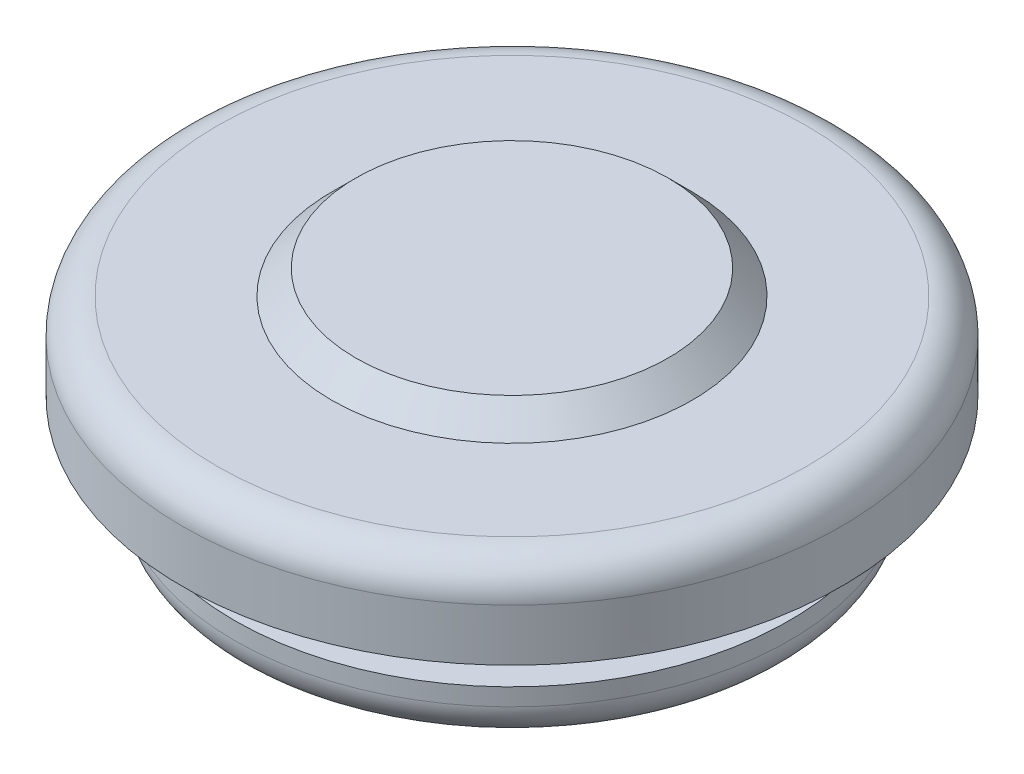
from build123d import *

# Parameters (mm, degrees)
FILLET_1_R     = 1
CHAMFER_1_SIZE = 0.7


with BuildPart() as part:
    # ｽｹｯﾁ1 → 回転1 (revolve)
    with BuildSketch(Plane.XY, mode=Mode.PRIVATE) as revolve_1_sk:
        Polygon((0, 6.3), (4.5, 6.3), (4.5, 5.6), (9.5, 5.6), (9.5, 3.1), (6, 3.1), (6, 1.5), (8, 1.5), (8, 0), (3.5, 0), (3.5, 5.6), (0, 5.6), align=None)
    revolve(revolve_1_sk.sketch.rotate(Axis((0, 0, 0), (0, 1, 0)), 90), axis=Axis((0, 0, 0), (0, 1, 0)))

    # ﾌｨﾚｯﾄ1
    fillet_1_edges = [part.edges().sort_by_distance(p)[0] for p in [
        (0, 0, 8),
        (0, 5.6, 9.5),
    ]]
    fillet(fillet_1_edges, radius=FILLET_1_R)

    # 面取り1
    chamfer_1_edges = [part.edges().sort_by_distance(p)[0] for p in [
        (0, 5.6, 4.5),
    ]]
    chamfer(chamfer_1_edges, length=CHAMFER_1_SIZE - 0.0001)  # a hair under: the kernel refuses the full size


solid = part.part
